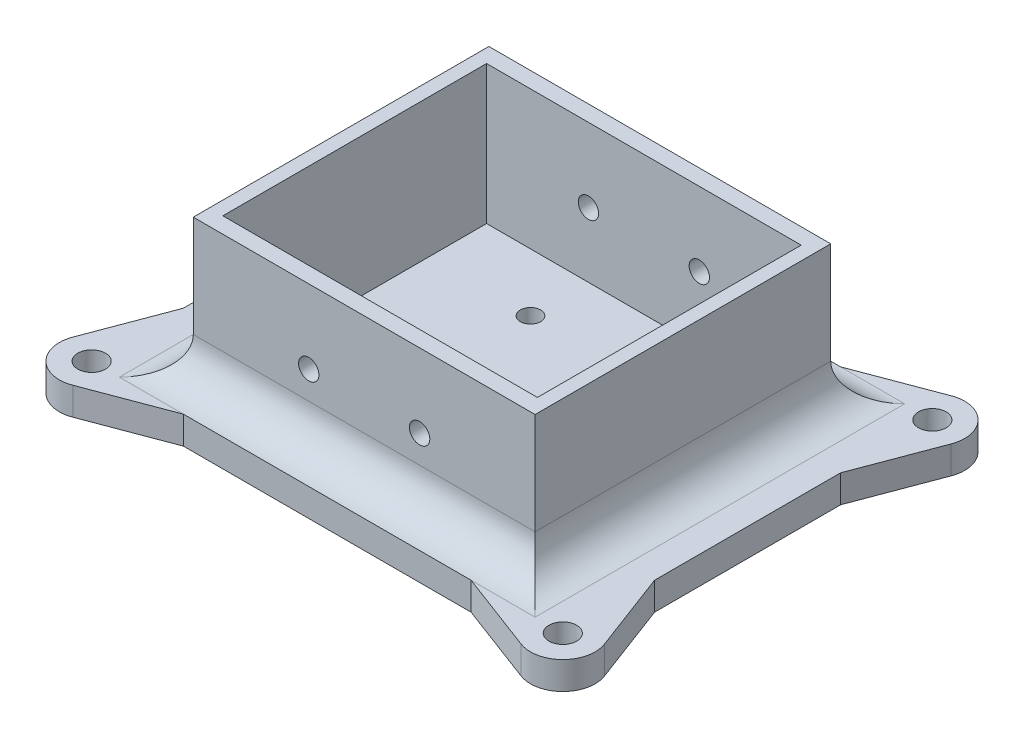
from build123d import *

# Parameters (mm, degrees)
SKETCH1_R               = 1.5
BOSS_EXTRUDE2_DEPTH     = 3
SKETCH2_W               = 37
SKETCH2_H               = 32
SKETCH2_W_2             = 34.05
SKETCH2_H_2             = 28.55
BOSS_EXTRUDE3_DEPTH     = 15
CUT_EXTRUDE1_DEPTH      = 40
CUT_EXTRUDE1_DEPTH_BACK = 11
SKETCH2_4_R             = 1.1
CUT_EXTRUDE2_DEPTH      = 11
FILLET1_R               = 4


with BuildPart() as part:
    # Sketch1 → Boss-Extrude2 (new body)
    with BuildSketch(Plane(origin=(0, 0, 0), x_dir=(1, 0, 0), z_dir=(0, 1, 0))):
        with BuildLine():
            Line((-24.266499455, 23.2754353), (-15.568913997, 20))
            Line((-15.568913997, 20), (15.568913997, 20))
            Line((15.568913997, 20), (24.266499455, 23.2754353))
            ThreePointArc((24.266499455, 23.2754353), (27.974873734, 22.474873734), (28.7754353, 18.766499455))
            Line((28.7754353, 18.766499455), (25.5, 10.068913997))
            Line((25.5, 10.068913997), (25.5, -10.068913997))
            Line((25.5, -10.068913997), (28.7754353, -18.766499455))
            ThreePointArc((28.7754353, -18.766499455), (27.974873734, -22.474873734), (24.266499455, -23.2754353))
            Line((24.266499455, -23.2754353), (15.568913997, -20))
            Line((15.568913997, -20), (-15.568913997, -20))
            Line((-15.568913997, -20), (-24.266499455, -23.2754353))
            ThreePointArc((-24.266499455, -23.2754353), (-27.974873734, -22.474873734), (-28.7754353, -18.766499455))
            Line((-28.7754353, -18.766499455), (-25.5, -10.068913997))
            Line((-25.5, -10.068913997), (-25.5, 10.068913997))
            Line((-25.5, 10.068913997), (-28.7754353, 18.766499455))
            ThreePointArc((-28.7754353, 18.766499455), (-27.974873734, 22.474873734), (-24.266499455, 23.2754353))
        make_face()
        with Locations(Location((-25.5, 20, 0), (0, 0, 270))):
            Circle(SKETCH1_R, mode=Mode.SUBTRACT)
        with Locations(Location((25.5, 20, 0), (0, 0, 270))):
            Circle(SKETCH1_R, mode=Mode.SUBTRACT)
        with Locations(Location((25.5, -20, 0), (0, 0, 270))):
            Circle(SKETCH1_R, mode=Mode.SUBTRACT)
        with Locations(Location((-25.5, -20, 0), (0, 0, 270))):
            Circle(SKETCH1_R, mode=Mode.SUBTRACT)
    extrude(amount=BOSS_EXTRUDE2_DEPTH)

    # Sketch2 → Boss-Extrude3 (add)
    with BuildSketch(Plane(origin=(0, 3, 0), x_dir=(1, 0, 0), z_dir=(0, 1, 0))):
        Rectangle(SKETCH2_W, SKETCH2_H)
        Rectangle(SKETCH2_W_2, SKETCH2_H_2, mode=Mode.SUBTRACT)
    extrude(amount=BOSS_EXTRUDE3_DEPTH)

    # Sketch3 → Cut-Extrude1 (cut, two sides: drawn at the far end of the back side and taken through both)
    with BuildSketch(Plane.XY.offset(-14.275).offset(-CUT_EXTRUDE1_DEPTH_BACK)):
        with BuildLine():
            ThreePointArc((-4.9, 10), (-6.777817459, 10.777817459), (-6, 8.9))
            Line((-6, 8.9), (-6, 10))
            Line((-6, 10), (-4.9, 10))
        make_face()
        with BuildLine():
            Line((-6, 10), (-6, 8.9))
            ThreePointArc((-6, 8.9), (-5.222182541, 9.222182541), (-4.9, 10))
            Line((-4.9, 10), (-6, 10))
        make_face()
        with BuildLine():
            ThreePointArc((4.9, 10), (5.222182541, 9.222182541), (6, 8.9))
            Line((6, 8.9), (6, 10))
            Line((6, 10), (4.9, 10))
        make_face()
        with BuildLine():
            Line((6, 10), (6, 8.9))
            ThreePointArc((6, 8.9), (6.777817459, 9.222182541), (7.1, 10))
            ThreePointArc((7.1, 10), (6, 11.1), (4.9, 10))
            Line((4.9, 10), (6, 10))
        make_face()
    extrude(amount=CUT_EXTRUDE1_DEPTH + CUT_EXTRUDE1_DEPTH_BACK, mode=Mode.SUBTRACT)

    # Sketch2<4> → Cut-Extrude2 (cut)
    with BuildSketch(Plane(origin=(0, 3, 0), x_dir=(1, 0, 0), z_dir=(0, 1, 0))):
        with Locations(Location((-6, 8, 0), (0, 0, 270))):
            Circle(SKETCH2_4_R)
        with Locations(Location((6, 8, 0), (0, 0, 270))):
            Circle(SKETCH2_4_R)
        with Locations(Location((6, -8, 0), (0, 0, 270))):
            Circle(SKETCH2_4_R)
        with Locations(Location((-6, -8, 0), (0, 0, 270))):
            Circle(SKETCH2_4_R)
    extrude(amount=-CUT_EXTRUDE2_DEPTH, mode=Mode.SUBTRACT)

    # Fillet1
    fillet1_edges = [part.edges().sort_by_distance(p)[0] for p in [
        (-18.5, 3, 0),
        (0, 3, 16),
        (18.5, 3, 0),
        (0, 3, -16),
    ]]
    fillet(fillet1_edges, radius=FILLET1_R - 0.0001)  # a hair under: the kernel refuses the full size


solid = part.part
